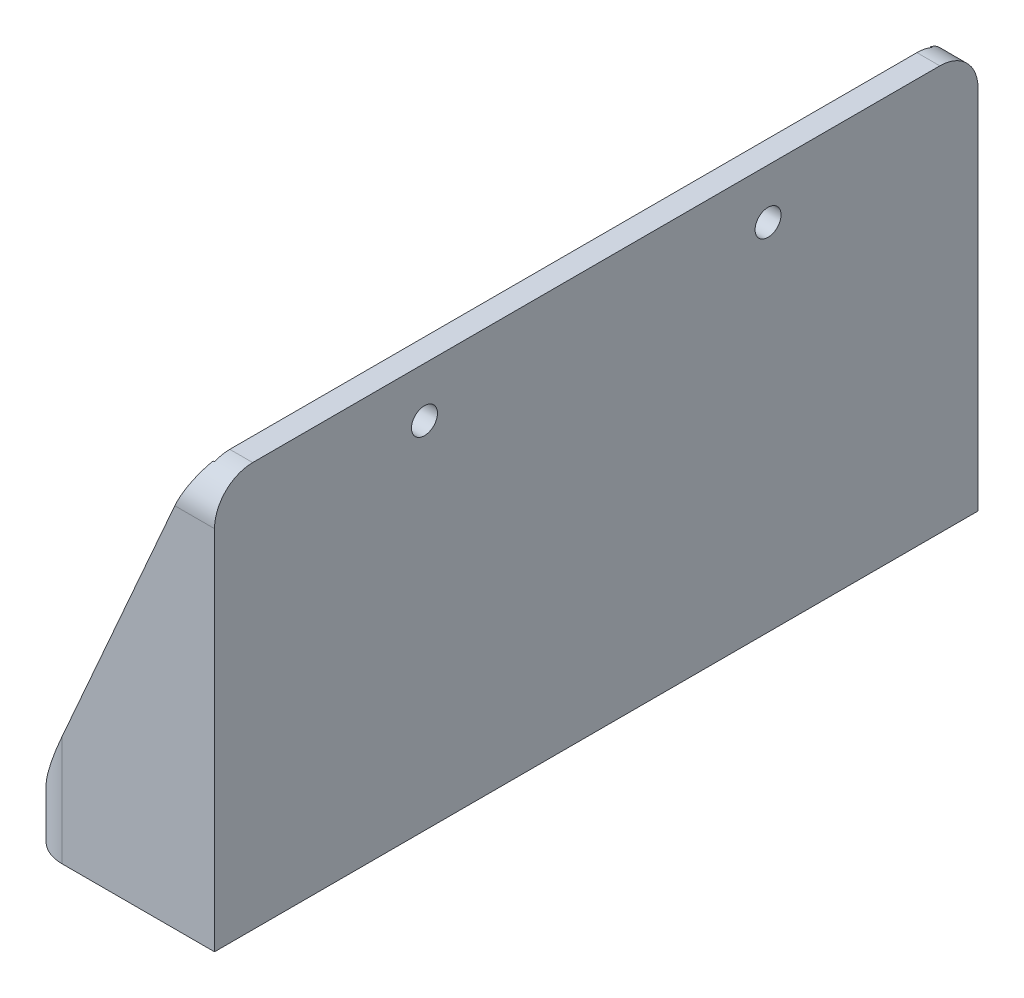
from build123d import *

# Parameters (mm, degrees)
SKETCH1_W           = 25
SKETCH1_H           = 100
BOSS_EXTRUDE1_DEPTH = 3
SKETCH2_W           = 3
SKETCH2_H           = 100
BOSS_EXTRUDE2_DEPTH = 50
SKETCH3_R           = 1.7
CUT_EXTRUDE1_DEPTH  = 25
SKETCH4_R           = 2.2
CUT_EXTRUDE2_DEPTH  = 25
FILLET1_R           = 5
BOSS_EXTRUDE3_DEPTH = 3
FILLET2_R           = 5


with BuildPart() as part:
    # Sketch1 → Boss-Extrude1 (new body)
    with BuildSketch(Plane(origin=(0, 0, 0), x_dir=(1, 0, 0), z_dir=(0, 1, 0))):
        Rectangle(SKETCH1_W, SKETCH1_H)
    extrude(amount=BOSS_EXTRUDE1_DEPTH)

    # Sketch2 → Boss-Extrude2 (add)
    with BuildSketch(Plane(origin=(0, 3, 0), x_dir=(1, 0, 0), z_dir=(0, 1, 0))):
        with Locations((11, 0)):
            Rectangle(SKETCH2_W, SKETCH2_H)
    extrude(amount=BOSS_EXTRUDE2_DEPTH)

    # Sketch3 → Cut-Extrude1 (cut)
    with BuildSketch(Plane.ZY.offset(-9.5)):
        with Locations((-22.5, 46.5)):
            Circle(SKETCH3_R)
        with Locations((22.5, 46.5)):
            Circle(SKETCH3_R)
    extrude(amount=-CUT_EXTRUDE1_DEPTH, mode=Mode.SUBTRACT)

    # Sketch4 → Cut-Extrude2 (cut)
    with BuildSketch(Plane(origin=(0, 3, 0), x_dir=(1, 0, 0), z_dir=(0, 1, 0))):
        with Locations(Location((-1.5, -1.579280152, 0), (0, 0, 270))):
            Circle(SKETCH4_R)
        with Locations(Location((-1.5, 38.420719848, 0), (0, 0, 270))):
            Circle(SKETCH4_R)
        with Locations(Location((-1.5, -41.579280152, 0), (0, 0, 270))):
            Circle(SKETCH4_R)
    extrude(amount=-CUT_EXTRUDE2_DEPTH, mode=Mode.SUBTRACT)

    # Fillet1
    fillet1_edges = [part.edges().sort_by_distance(p)[0] for p in [
        (9.5, 3, 0),
    ]]
    fillet(fillet1_edges, radius=FILLET1_R)

    # Sketch5 → Boss-Extrude3 (add)
    with BuildSketch(Plane.XY.offset(50)):
        with BuildLine():
            Line((9.5, 53), (-12.5, 3))
            Line((-12.5, 3), (4.5, 3))
            ThreePointArc((4.5, 3), (8.035533906, 4.464466094), (9.5, 8))
            Line((9.5, 8), (9.5, 53))
        make_face()
    boss_extrude3 = extrude(amount=-BOSS_EXTRUDE3_DEPTH)

    # Mirror1: Boss-Extrude3 across plane
    add(boss_extrude3.mirror(Plane.XY))

    # Fillet2
    # the kernel refuses this fillet: 5 mm, written as the material it takes off along each edge
    with BuildSketch(Plane(origin=(25, 53, -50), x_dir=(0, 0, 1), z_dir=(-1, 0, 0))) as fillet2_piece_1:
        with BuildLine():
            CenterArc((FILLET2_R, -FILLET2_R), FILLET2_R, 90, 90)
            Line((0, -FILLET2_R), (0, 0))
            Line((0, 0), (FILLET2_R, 0))
        make_face()
    extrude(amount=28, mode=Mode.SUBTRACT)
    with BuildSketch(Plane(origin=(-3, 53, 50), x_dir=(0, -1, 0), z_dir=(1, 0, 0)), Plane(origin=(-12.5, -12.5, -50), x_dir=(0, 0, 1), z_dir=(0, 1, 0)), Plane(origin=(-12.5, -12.5, 50), x_dir=(1, 0, 0), z_dir=(0, 1, 0))) as fillet2_piece_2:
        with BuildLine():
            CenterArc((FILLET2_R, FILLET2_R), FILLET2_R, 180, 90)
            Line((0, FILLET2_R), (0, 0))
            Line((0, 0), (FILLET2_R, 0))
        make_face()
    extrude(amount=28, mode=Mode.SUBTRACT)


solid = part.part
